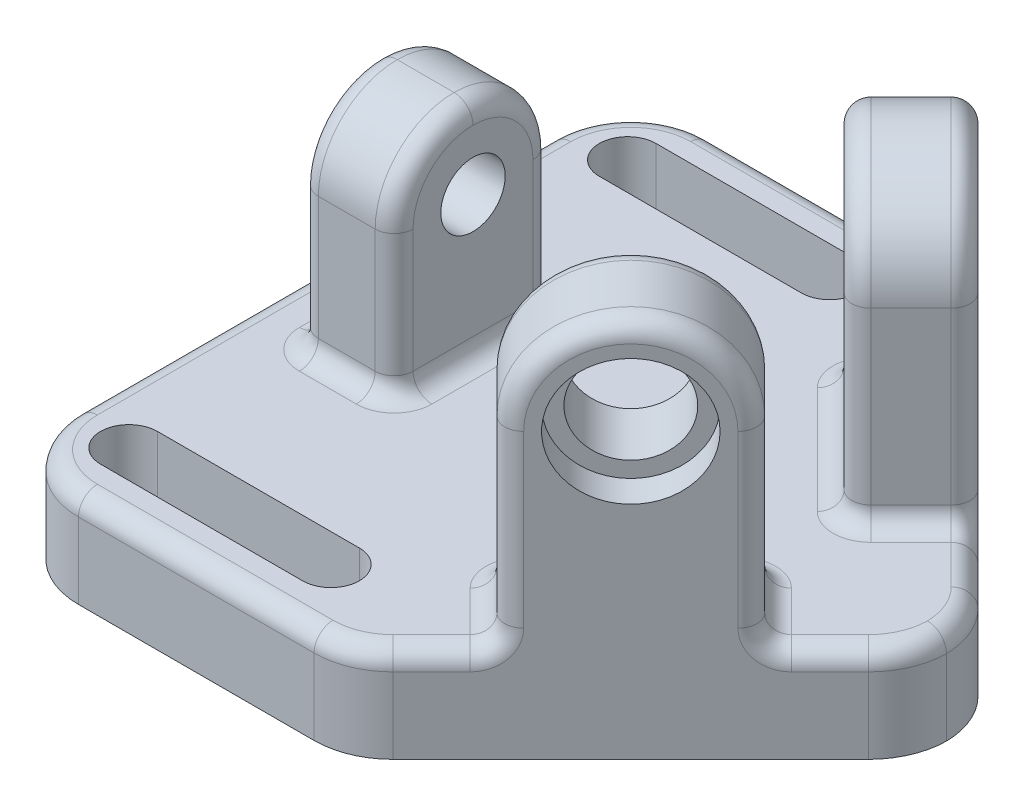
from build123d import *

# Parameters (mm, degrees)
ESBO_O1_W                                            = 100
ESBO_O1_H                                            = 100.00000000000001
RESSALTO_EXTRUS_O1_DEPTH                             = 15
CHANFRO1_SIZE                                        = 45
RESSALTO_EXTRUS_O2_DEPTH                             = 15
REBAIXO_PARA_PARAFUSO_ALLEN_SEXTAVADO_DE_D           = 15
REBAIXO_PARA_PARAFUSO_ALLEN_SEXTAVADO_DE_CBORE_D     = 20
REBAIXO_PARA_PARAFUSO_ALLEN_SEXTAVADO_DE_CBORE_DEPTH = 5
ESBO_O6_W                                            = 15
ESBO_O6_H                                            = 25.000000000000004
RESSALTO_EXTRUS_O3_DEPTH                             = 35
FILETE1_R                                            = 12.5
FURO_ROSCADO_DE_M121_D                               = 10.2
CORTE_EXTRUS_O1_DEPTH                                = 35
FILETE2_R                                            = 12.5
FILETE4_R                                            = 12.5
FILETE5_R                                            = 3


# Some blends are built 0.0001 mm under size
with BuildPart() as part:
    # Esboço1 → Ressalto-extrusão1 (new body)
    with BuildSketch(Plane(origin=(0, 0, 0), x_dir=(1, 0, 0), z_dir=(0, 1, 0))):
        Rectangle(ESBO_O1_W, ESBO_O1_H)
    extrude(amount=-RESSALTO_EXTRUS_O1_DEPTH)

    # Chanfro1
    chanfro1_edges = [part.edges().sort_by_distance(p)[0] for p in [
        (49.99999999999999, -7.5, 50),
        (49.99999999999999, -7.5, -50),
    ]]
    chamfer(chanfro1_edges, length=CHANFRO1_SIZE)

    # Esboço2 → Ressalto-extrusão2 (add)
    with BuildSketch(Plane(origin=(27.500000000000025, 0, 27.499999999999932), x_dir=(0.7071067811865465, 0, -0.7071067811865487), z_dir=(0.7071067811865487, 0, 0.7071067811865465))):
        with BuildLine():
            Line((-15, 0), (15, 0))
            Line((15, 0), (15, 30))
            ThreePointArc((15, 30), (9.2e-16, 45), (-15, 30))
            Line((-15, 30), (-15, 0))
        make_face()
    ressalto_extrus_o2 = extrude(amount=-RESSALTO_EXTRUS_O2_DEPTH)

    # Rebaixo para parafuso Allen sextavado de M121 (through all)
    with Locations(Plane(origin=(27.500000000000025, 0, 27.499999999999932), x_dir=(0.7071067811865465, 0, -0.7071067811865487), z_dir=(0.7071067811865487, 0, 0.7071067811865465))):
        with Locations((0, 30)):
            rebaixo_para_parafuso_allen_sextavado_de = CounterBoreHole(REBAIXO_PARA_PARAFUSO_ALLEN_SEXTAVADO_DE_D / 2, REBAIXO_PARA_PARAFUSO_ALLEN_SEXTAVADO_DE_CBORE_D / 2, REBAIXO_PARA_PARAFUSO_ALLEN_SEXTAVADO_DE_CBORE_DEPTH)

    # Espelhar1: Ressalto-extrusão2, Rebaixo para parafuso Allen sextavado de M121 across plane
    add(ressalto_extrus_o2.mirror(Plane.XY))
    add(rebaixo_para_parafuso_allen_sextavado_de.mirror(Plane.XY), mode=Mode.SUBTRACT)

    # Esboço6 → Ressalto-extrusão3 (add)
    with BuildSketch(Plane(origin=(0, 0, 0), x_dir=(1, 0, 0), z_dir=(0, 1, 0))):
        with Locations((-32.50000000000001, 0)):
            Rectangle(ESBO_O6_W, ESBO_O6_H)
    extrude(amount=RESSALTO_EXTRUS_O3_DEPTH)

    # Filete1
    filete1_edges = [part.edges().sort_by_distance(p)[0] for p in [
        (-32.50000000000001, 35, -12.5),
        (-32.50000000000001, 35, 12.5),
    ]]
    fillet(filete1_edges, radius=FILETE1_R - 0.0001)  # a hair under: the kernel refuses the full size

    # Furo roscado de M121 (through all)
    with Locations(Plane.ZY.offset(40.00000000000001)):
        with Locations((0, 22.5)):
            Hole(FURO_ROSCADO_DE_M121_D / 2)

    # Esboço9 → Corte-extrusão1 (cut)
    with BuildSketch(Plane(origin=(0, 0, 0), x_dir=(1, 0, 0), z_dir=(0, 1, 0))):
        with BuildLine():
            Line((-8.000000000000007, 34.99999999999999), (-40.00000000000001, 34.99999999999999))
            ThreePointArc((-40.00000000000001, 34.99999999999999), (-44.500000000000014, 39.499999999999986), (-40.00000000000001, 43.99999999999999))
            Line((-40.00000000000001, 43.99999999999999), (-8.000000000000009, 44))
            ThreePointArc((-8.000000000000009, 44), (-3.500000000000007, 39.49999999999999), (-8.000000000000007, 34.99999999999999))
        make_face()
    corte_extrus_o1 = extrude(amount=-CORTE_EXTRUS_O1_DEPTH, mode=Mode.SUBTRACT)

    # Espelhar2: Corte-extrusão1 across plane
    add(corte_extrus_o1.mirror(Plane.XY), mode=Mode.SUBTRACT)

    # Filete2
    filete2_edges = [part.edges().sort_by_distance(p)[0] for p in [
        (4.999999999999993, -7.5, 50),
        (-50.00000000000001, -7.5, 50),
        (-50.00000000000001, -7.5, -50),
    ]]
    fillet(filete2_edges, radius=FILETE2_R)

    # Filete4
    # the kernel refuses this fillet: 12.5 mm, written as the material it takes off along each edge
    with BuildSketch(Plane(origin=(4.999999999999993, 12.944173824159222, -50), x_dir=(-1, 0, 0), z_dir=(0, -1, 0))) as filete4_piece_1:
        with BuildLine():
            CenterArc((FILETE4_R * 0.414213562373, -FILETE4_R), FILETE4_R, 90, 45)
            Line((-FILETE4_R * 0.292893218813, -FILETE4_R * 0.292893218813), (0, 0))
            Line((0, 0), (FILETE4_R * 0.414213562373, 0))
        make_face()
    extrude(amount=40.888347648318444, mode=Mode.SUBTRACT)
    with BuildSketch(Plane(origin=(49.99999999999999, 12.944173824159222, -5), x_dir=(-0.7071067811865472, 0, -0.7071067811865479), z_dir=(0, -1, 0))) as filete4_piece_2:
        with BuildLine():
            CenterArc((FILETE4_R * 0.414213562373, -FILETE4_R), FILETE4_R, 89.99999999999997, 44.99999999999997)
            Line((-FILETE4_R * 0.292893218813, -FILETE4_R * 0.292893218813), (0, 0))
            Line((0, 0), (FILETE4_R * 0.414213562373, -1.2e-16))
        make_face()
    extrude(amount=40.888347648318444, mode=Mode.SUBTRACT)
    with BuildSketch(Plane(origin=(50, 12.944173824159222, 4.9999999999999964), x_dir=(-0.7071067811865479, 0, 0.7071067811865471), z_dir=(0, -1, 0))) as filete4_piece_3:
        with BuildLine():
            CenterArc((FILETE4_R * 0.414213562373, FILETE4_R), FILETE4_R, 225, 44.99999999999994)
            Line((-FILETE4_R * 0.292893218813, FILETE4_R * 0.292893218813), (0, 0))
            Line((0, 0), (FILETE4_R * 0.414213562373, -5.5e-16))
        make_face()
    extrude(amount=40.888347648318444, mode=Mode.SUBTRACT)

    # Filete5
    # the kernel refuses this fillet: 3 mm, written as the material it takes off along each edge
    with BuildSketch(Plane(origin=(16.893398282201794, 30, 16.893398282201737), x_dir=(0.7071067811865465, 0, -0.7071067811865486), z_dir=(0, -1, 0))) as filete5_piece_1:
        with BuildLine():
            CenterArc((15.000000000000002 - FILETE5_R, FILETE5_R), FILETE5_R, 269.99999999999994, 90.0000000000001)
            Line((15.000000000000007, FILETE5_R), (15.000000000000002, 2e-16))
            Line((15.000000000000002, 2e-16), (15.000000000000002 - FILETE5_R, -2.5e-15))
        make_face()
    revolve(axis=Axis((16.893398282201794, 30, 16.893398282201737), (0.7071067811865487, 0, 0.7071067811865465)), revolution_arc=180, mode=Mode.SUBTRACT)
    with BuildSketch(Plane(origin=(6.286796564403597, 30, 27.499999999999968), x_dir=(0.7071067811865464, 0, -0.7071067811865487), z_dir=(0, -1, 0))) as filete5_piece_2:
        with BuildLine():
            CenterArc((FILETE5_R, FILETE5_R), FILETE5_R, 179.99999999999991, 90.00000000000011)
            Line((-1e-17, FILETE5_R), (0, 0))
            Line((0, 0), (FILETE5_R, -2e-17))
        make_face()
    extrude(amount=30, mode=Mode.SUBTRACT)
    with BuildSketch(Plane(origin=(27.499999999999993, 0, 6.286796564403506), x_dir=(0.7071067811865487, 0, 0.7071067811865464), z_dir=(0, 1, 0))) as filete5_piece_3:
        with BuildLine():
            CenterArc((FILETE5_R, -FILETE5_R), FILETE5_R, 90, 89.99999999999994)
            Line((-2.49e-15, -FILETE5_R), (0, 0))
            Line((0, 0), (FILETE5_R, 6e-17))
        make_face()
    extrude(amount=30, mode=Mode.SUBTRACT)
    with BuildSketch(Plane(origin=(27.499999999999993, 0, -6.286796564403513), x_dir=(-0.7071067811865446, 0, -0.7071067811865506), z_dir=(0, 1, 0))) as filete5_piece_4:
        with BuildLine():
            CenterArc((FILETE5_R, -FILETE5_R), FILETE5_R, 90.00000000000016, 89.99999999999982)
            Line((5.21e-15, -FILETE5_R), (0, 0))
            Line((0, 0), (FILETE5_R, 1.2e-16))
        make_face()
    extrude(amount=30, mode=Mode.SUBTRACT)
    with BuildSketch(Plane(origin=(16.893398282201797, 30, -16.89339828220175), x_dir=(0.7071067811865462, 0, 0.7071067811865488), z_dir=(0, -1, 0))) as filete5_piece_5:
        with BuildLine():
            CenterArc((15.000000000000004 - FILETE5_R, -FILETE5_R), FILETE5_R, 3.393e-14, 89.99999999999994)
            Line((15.000000000000004, -FILETE5_R), (15.000000000000004, 8.4e-16))
            Line((15.000000000000004, 8.4e-16), (15.000000000000004 - FILETE5_R, -2.42e-15))
        make_face()
    revolve(axis=Axis((16.893398282201797, 30, -16.89339828220175), (-0.7071067811865487, 0, 0.7071067811865465)), revolution_arc=180, mode=Mode.SUBTRACT)
    with BuildSketch(Plane(origin=(6.286796564403595, 30, -27.49999999999998), x_dir=(0.7071067811865517, 0, -0.7071067811865434), z_dir=(0, -1, 0))) as filete5_piece_6:
        with BuildLine():
            CenterArc((FILETE5_R, FILETE5_R), FILETE5_R, 180.00000000000006, 89.99999999999972)
            Line((1.507e-14, FILETE5_R), (0, 0))
            Line((0, 0), (FILETE5_R, -1.7e-16))
        make_face()
    extrude(amount=30, mode=Mode.SUBTRACT)
    with BuildSketch(Plane(origin=(-40.00000000000001, 0, 12.500000000000002), x_dir=(0, 0, -1), z_dir=(0, 1, 0))) as filete5_piece_7:
        with BuildLine():
            CenterArc((FILETE5_R, -FILETE5_R), FILETE5_R, 90, 90)
            Line((3.55e-15, -FILETE5_R), (0, 0))
            Line((0, 0), (FILETE5_R, 0))
        make_face()
    extrude(amount=22.500100000000003, mode=Mode.SUBTRACT)
    with BuildSketch(Plane(origin=(-40.00000000000001, 0, -12.500000000000002), x_dir=(1, 0, 0), z_dir=(0, 1, 0))) as filete5_piece_8:
        with BuildLine():
            CenterArc((FILETE5_R, -FILETE5_R), FILETE5_R, 90, 90)
            Line((0, -FILETE5_R), (0, 0))
            Line((0, 0), (FILETE5_R, 0))
        make_face()
    extrude(amount=22.500100000000003, mode=Mode.SUBTRACT)
    with BuildSketch(Plane(origin=(-40.00000000000001, 22.500100000000003, 0.00010000000000332), x_dir=(0, 0, 1), z_dir=(0, -1, 0))) as filete5_piece_9:
        with BuildLine():
            CenterArc((12.4999 - FILETE5_R, -FILETE5_R), FILETE5_R, 0, 90)
            Line((12.499900000000002, -FILETE5_R), (12.4999, 0))
            Line((12.4999, 0), (12.4999 - FILETE5_R, 0))
        make_face()
    revolve(axis=Axis((-40.00000000000001, 22.500100000000003, 0.00010000000000332), (-1, 0, 1.2e-16)), revolution_arc=90, mode=Mode.SUBTRACT)
    with BuildSketch(Plane(origin=(-40.00000000000001, 22.500100000000003, -0.0001000000000051), x_dir=(0, 0, -1), z_dir=(0, -1, 0))) as filete5_piece_10:
        with BuildLine():
            CenterArc((12.4999 - FILETE5_R, FILETE5_R), FILETE5_R, 270, 90)
            Line((12.499899999999998, FILETE5_R), (12.4999, 0))
            Line((12.4999, 0), (12.4999 - FILETE5_R, 0))
        make_face()
    revolve(axis=Axis((-40.00000000000001, 22.500100000000003, -0.0001000000000051), (1, 0, 1.2e-16)), revolution_arc=90, mode=Mode.SUBTRACT)
    with BuildSketch(Plane(origin=(-25.000000000000007, 0, -12.5), x_dir=(-1, 0, 0), z_dir=(0, 1, 0)), Plane(origin=(-25.000000000000007, 0, 12.5), x_dir=(0, 0, -1), z_dir=(0, 1, 0))) as filete5_piece_11:
        with BuildLine():
            CenterArc((FILETE5_R, FILETE5_R), FILETE5_R, 180, 90)
            Line((0, FILETE5_R), (0, 0))
            Line((0, 0), (FILETE5_R, 0))
        make_face()
    extrude(amount=22.500100000000003, mode=Mode.SUBTRACT)
    with BuildSketch(Plane(origin=(-25.000000000000007, 22.500100000000003, 0.00010000000000154), x_dir=(0, 0, 1), z_dir=(0, -1, 0))) as filete5_piece_12:
        with BuildLine():
            CenterArc((12.4999 - FILETE5_R, FILETE5_R), FILETE5_R, 270, 90)
            Line((12.4999, FILETE5_R), (12.4999, 0))
            Line((12.4999, 0), (12.4999 - FILETE5_R, 0))
        make_face()
    revolve(axis=Axis((-25.000000000000007, 22.500100000000003, 0.00010000000000154), (-1, 0, 1.2e-16)), revolution_arc=90, mode=Mode.SUBTRACT)
    with BuildSketch(Plane(origin=(-25.000000000000007, 22.500100000000003, -0.00010000000000332), x_dir=(0, 0, -1), z_dir=(0, -1, 0))) as filete5_piece_13:
        with BuildLine():
            CenterArc((12.4999 - FILETE5_R, -FILETE5_R), FILETE5_R, 0, 90)
            Line((12.4999, -FILETE5_R), (12.4999, 0))
            Line((12.4999, 0), (12.4999 - FILETE5_R, 0))
        make_face()
    revolve(axis=Axis((-25.000000000000007, 22.500100000000003, -0.00010000000000332), (1, 0, 1.2e-16)), revolution_arc=90, mode=Mode.SUBTRACT)
    with BuildSketch(Plane(origin=(-25.000000000000007, 35, 0.00010000000000154), x_dir=(0, -1, 0), z_dir=(0, 0, -1))) as filete5_piece_14:
        with BuildLine():
            CenterArc((FILETE5_R, FILETE5_R), FILETE5_R, 180, 90)
            Line((0, FILETE5_R), (0, 0))
            Line((0, 0), (FILETE5_R, 0))
        make_face()
    extrude(amount=0.00020000000000486, mode=Mode.SUBTRACT)
    with BuildSketch(Plane(origin=(-40.00000000000001, 35, -0.0001000000000051), x_dir=(0, -1, 0), z_dir=(0, 0, 1))) as filete5_piece_15:
        with BuildLine():
            CenterArc((FILETE5_R, FILETE5_R), FILETE5_R, 180, 90)
            Line((0, FILETE5_R), (0, 0))
            Line((0, 0), (FILETE5_R, 0))
        make_face()
    extrude(amount=0.00020000000000842, mode=Mode.SUBTRACT)
    # the kernel refuses this fillet: 3 mm, written as the material it adds along each edge
    with BuildSketch(Plane(origin=(8.408116907963237, 0, 25.37867965644032), x_dir=(-0.7071067811865487, 0, -0.7071067811865464), z_dir=(0.7071067811865465, 0, -0.7071067811865487))) as filete5_2_piece_1:
        with BuildLine():
            CenterArc((FILETE5_R, FILETE5_R), FILETE5_R, 180, 90)
            Line((0, FILETE5_R), (0, 0))
            Line((0, 0), (FILETE5_R, 0))
        make_face()
    extrude(amount=24.00000000000001)
    with BuildSketch(Plane(origin=(38.10660171779822, 0, 16.8933982822017), x_dir=(0.7071067811865464, 0, -0.7071067811865487), z_dir=(-0.7071067811865487, 0, -0.7071067811865464))) as filete5_2_piece_2:
        with BuildLine():
            CenterArc((FILETE5_R, -FILETE5_R), FILETE5_R, 90, 90)
            Line((0, -FILETE5_R), (0, 0))
            Line((0, 0), (FILETE5_R, 0))
        make_face()
    extrude(amount=11.999999999999996)
    with BuildSketch(Plane(origin=(16.89339828220183, 0, 38.10660171779816), x_dir=(-0.7071067811865464, 0, 0.7071067811865487), z_dir=(-0.7071067811865487, 0, -0.7071067811865464))) as filete5_2_piece_3:
        with BuildLine():
            CenterArc((FILETE5_R, FILETE5_R), FILETE5_R, 180, 90)
            Line((0, FILETE5_R), (0, 0))
            Line((0, 0), (FILETE5_R, 0))
        make_face()
    extrude(amount=11.999999999999998)
    with BuildSketch(Plane(origin=(16.89339828220183, 0, -38.10660171779816), x_dir=(-0.7071067811865464, 0, -0.7071067811865487), z_dir=(-0.7071067811865487, 0, 0.7071067811865464))) as filete5_2_piece_4:
        with BuildLine():
            CenterArc((FILETE5_R, -FILETE5_R), FILETE5_R, 90, 90)
            Line((0, -FILETE5_R), (0, 0))
            Line((0, 0), (FILETE5_R, 0))
        make_face()
    extrude(amount=11.999999999999995)
    with BuildSketch(Plane(origin=(38.10660171779822, 0, -16.8933982822017), x_dir=(0.7071067811865464, 0, 0.7071067811865487), z_dir=(-0.7071067811865487, 0, 0.7071067811865464))) as filete5_2_piece_5:
        with BuildLine():
            CenterArc((FILETE5_R, FILETE5_R), FILETE5_R, 180, 90)
            Line((0, FILETE5_R), (0, 0))
            Line((0, 0), (FILETE5_R, 0))
        make_face()
    extrude(amount=11.999999999999996)
    with BuildSketch(Plane(origin=(8.408116907963233, 0, -25.378679656440333), x_dir=(-0.7071067811865487, 0, 0.7071067811865464), z_dir=(0.7071067811865465, 0, 0.7071067811865487))) as filete5_2_piece_6:
        with BuildLine():
            CenterArc((FILETE5_R, -FILETE5_R), FILETE5_R, 90, 90)
            Line((-2.51e-15, -FILETE5_R), (0, 0))
            Line((0, 0), (FILETE5_R, 0))
        make_face()
    extrude(amount=24.000000000000018)
    with BuildSketch(Plane(origin=(-40.00000000000001, 0, -9.5), x_dir=(-1, 0, 0), z_dir=(0, 0, 1))) as filete5_2_piece_7:
        with BuildLine():
            CenterArc((FILETE5_R, -FILETE5_R), FILETE5_R, 90, 90)
            Line((0, -FILETE5_R), (0, 0))
            Line((0, 0), (FILETE5_R, 0))
        make_face()
    extrude(amount=19)
    with BuildSketch(Plane(origin=(-37.00000000000001, 0, 12.500000000000002), x_dir=(1.2e-16, 0, 1), z_dir=(1, 0, -1.2e-16)), Plane(origin=(-28.000000000000007, 0, -12.5), x_dir=(1.2e-16, 0, -1), z_dir=(-1, 0, -1.2e-16))) as filete5_2_piece_8:
        with BuildLine():
            CenterArc((FILETE5_R, -FILETE5_R), FILETE5_R, 90, 90)
            Line((0, -FILETE5_R), (0, 0))
            Line((0, 0), (FILETE5_R, 0))
        make_face()
    extrude(amount=9)
    with BuildSketch(Plane(origin=(-25.000000000000007, 0, 9.5), x_dir=(1, 0, 0), z_dir=(0, 0, -1))) as filete5_2_piece_9:
        with BuildLine():
            CenterArc((FILETE5_R, -FILETE5_R), FILETE5_R, 90, 90)
            Line((0, -FILETE5_R), (0, 0))
            Line((0, 0), (FILETE5_R, 0))
        make_face()
    extrude(amount=19)
    with BuildSketch(Plane(origin=(-28.000000000000007, 0, -9.5), x_dir=(0, 0, -1), z_dir=(-1, 0, 0))) as filete5_2_piece_10:
        with BuildLine():
            CenterArc((3 + FILETE5_R, -FILETE5_R), FILETE5_R, 90, 90)
            Line((3, -FILETE5_R), (3, 0))
            Line((3, 0), (3 + FILETE5_R, 0))
        make_face()
    revolve(axis=Axis((-28.000000000000007, 0, -9.5), (0, -1, 0)), revolution_arc=90)
    with BuildSketch(Plane(origin=(-37.00000000000001, 0, -9.500000000000002), x_dir=(0, 0, -1), z_dir=(1, 0, 0))) as filete5_2_piece_11:
        with BuildLine():
            CenterArc((3 + FILETE5_R, FILETE5_R), FILETE5_R, 180, 90)
            Line((3, FILETE5_R), (3, 0))
            Line((3, 0), (3 + FILETE5_R, 0))
        make_face()
    revolve(axis=Axis((-37.00000000000001, 0, -9.500000000000002), (0, 1, 0)), revolution_arc=90.00000000000004)
    with BuildSketch(Plane(origin=(-28.000000000000007, 0, 9.5), x_dir=(1, 0, 0), z_dir=(0, 0, -1))) as filete5_2_piece_12:
        with BuildLine():
            CenterArc((3 + FILETE5_R, -FILETE5_R), FILETE5_R, 90, 90)
            Line((3, -FILETE5_R), (3, 0))
            Line((3, 0), (3 + FILETE5_R, 0))
        make_face()
    revolve(axis=Axis((-28.000000000000007, 0, 9.5), (0, -1, 0)), revolution_arc=90)
    with BuildSketch(Plane(origin=(-37.00000000000001, 0, 9.499999999999998), x_dir=(-1, 0, 0), z_dir=(0, 0, -1))) as filete5_2_piece_13:
        with BuildLine():
            CenterArc((3 + FILETE5_R, FILETE5_R), FILETE5_R, 180, 90)
            Line((3, FILETE5_R), (3, 0))
            Line((3, 0), (3 + FILETE5_R, 0))
        make_face()
    revolve(axis=Axis((-37.00000000000001, 0, 9.499999999999998), (0, 1, 0)), revolution_arc=90)
    with BuildSketch(Plane(origin=(10.52943725152289, 0, -27.499999999999964), x_dir=(-0.7071067811865464, 0, -0.7071067811865487), z_dir=(0.7071067811865487, 0, -0.7071067811865464))) as filete5_2_piece_14:
        with BuildLine():
            CenterArc((2.999999999999999 + FILETE5_R, FILETE5_R), FILETE5_R, 180, 90)
            Line((2.999999999999999, FILETE5_R), (2.999999999999999, 0))
            Line((2.999999999999999, 0), (2.999999999999999 + FILETE5_R, 0))
        make_face()
    revolve(axis=Axis((10.52943725152289, 0, -27.499999999999964), (0, 1, 0)), revolution_arc=89.99999999999972)
    with BuildSketch(Plane(origin=(27.500000000000007, 0, -10.5294372515228), x_dir=(-0.7071067811865487, 0, 0.7071067811865464), z_dir=(-0.7071067811865464, 0, -0.7071067811865487))) as filete5_2_piece_15:
        with BuildLine():
            CenterArc((2.999999999999999 + FILETE5_R, FILETE5_R), FILETE5_R, 180, 90)
            Line((2.999999999999999, FILETE5_R), (2.999999999999999, 0))
            Line((2.999999999999999, 0), (2.999999999999999 + FILETE5_R, 0))
        make_face()
    revolve(axis=Axis((27.500000000000007, 0, -10.5294372515228), (0, 1, 0)), revolution_arc=89.99999999999982)
    with BuildSketch(Plane(origin=(10.52943725152288, 0, 27.49999999999996), x_dir=(-0.7071067811865487, 0, -0.7071067811865464), z_dir=(0.7071067811865464, 0, -0.7071067811865487))) as filete5_2_piece_16:
        with BuildLine():
            CenterArc((2.999999999999999 + FILETE5_R, FILETE5_R), FILETE5_R, 180, 90)
            Line((3.0000000000000004, FILETE5_R), (2.999999999999999, 0))
            Line((2.999999999999999, 0), (2.999999999999999 + FILETE5_R, 0))
        make_face()
    revolve(axis=Axis((10.52943725152288, 0, 27.49999999999996), (0, 1, 0)), revolution_arc=90.0000000000001)
    with BuildSketch(Plane(origin=(27.5, 0, 10.52943725152279), x_dir=(0.7071067811865464, 0, -0.7071067811865487), z_dir=(0.7071067811865487, 0, 0.7071067811865464))) as filete5_2_piece_17:
        with BuildLine():
            CenterArc((2.999999999999999 + FILETE5_R, FILETE5_R), FILETE5_R, 180, 90)
            Line((2.999999999999999, FILETE5_R), (2.999999999999999, 0))
            Line((2.999999999999999, 0), (2.999999999999999 + FILETE5_R, 0))
        make_face()
    revolve(axis=Axis((27.5, 0, 10.52943725152279), (0, 1, 0)), revolution_arc=89.99999999999994)
    # the kernel refuses this fillet: 3 mm, written as the material it takes off along each edge
    with BuildSketch(Plane(origin=(-37.500000000000014, 0, 50), x_dir=(0, 0, -1), z_dir=(1, 0, 0))) as filete5_3_piece_1:
        with BuildLine():
            CenterArc((FILETE5_R, -FILETE5_R), FILETE5_R, 90, 90)
            Line((0, -FILETE5_R), (0, 0))
            Line((0, 0), (FILETE5_R, 0))
        make_face()
    extrude(amount=37.32233047033633, mode=Mode.SUBTRACT)
    with BuildSketch(Plane(origin=(-50.00000000000001, 0, -37.5), x_dir=(1, 0, 0), z_dir=(0, 0, 1))) as filete5_3_piece_2:
        with BuildLine():
            CenterArc((FILETE5_R, -FILETE5_R), FILETE5_R, 90, 90)
            Line((0, -FILETE5_R), (0, 0))
            Line((0, 0), (FILETE5_R, 0))
        make_face()
    extrude(amount=75, mode=Mode.SUBTRACT)
    with BuildSketch(Plane(origin=(8.661165235168156, 0, 46.338834764831844), x_dir=(-0.7071067811865476, 0, -0.7071067811865476), z_dir=(0.7071067811865476, 0, -0.7071067811865476))) as filete5_3_piece_3:
        with BuildLine():
            CenterArc((FILETE5_R, -FILETE5_R), FILETE5_R, 90, 90)
            Line((2.51e-15, -FILETE5_R), (0, 0))
            Line((0, 0), (FILETE5_R, 0))
        make_face()
    extrude(amount=8.642135623731017, mode=Mode.SUBTRACT)
    with BuildSketch(Plane(origin=(-37.500000000000014, 0, 37.5), x_dir=(0, 0, 1), z_dir=(1, 0, 0))) as filete5_3_piece_4:
        with BuildLine():
            CenterArc((12.5 - FILETE5_R, FILETE5_R), FILETE5_R, 270, 89.99999999999999)
            Line((12.5, FILETE5_R), (12.5, 0))
            Line((12.5, 0), (12.5 - FILETE5_R, 0))
        make_face()
    revolve(axis=Axis((-37.500000000000014, 0, 37.5), (0, -1, 0)), revolution_arc=90, mode=Mode.SUBTRACT)
    with BuildSketch(Plane(origin=(-37.500000000000014, 0, -37.5), x_dir=(-1, 0, 0), z_dir=(0, 0, 1))) as filete5_3_piece_5:
        with BuildLine():
            CenterArc((12.5 - FILETE5_R, FILETE5_R), FILETE5_R, 270, 89.99999999999999)
            Line((12.5, FILETE5_R), (12.5, 0))
            Line((12.5, 0), (12.5 - FILETE5_R, 0))
        make_face()
    revolve(axis=Axis((-37.500000000000014, 0, -37.5), (0, -1, 0)), revolution_arc=90, mode=Mode.SUBTRACT)
    with BuildSketch(Plane(origin=(-0.1776695296636852, 0, 37.5), x_dir=(-1.2e-16, 0, 1), z_dir=(-1, 0, -1.2e-16))) as filete5_3_piece_6:
        with BuildLine():
            CenterArc((12.5 - FILETE5_R, -FILETE5_R), FILETE5_R, 8.48e-15, 90)
            Line((12.5, -FILETE5_R), (12.5, 0))
            Line((12.5, 0), (12.5 - FILETE5_R, 0))
        make_face()
    revolve(axis=Axis((-0.1776695296636852, 0, 37.5), (0, 1, 0)), revolution_arc=44.99999999999997, mode=Mode.SUBTRACT)
    with BuildSketch(Plane(origin=(-0.17766952966250216, 0, -50), x_dir=(0, 0, 1), z_dir=(-1, 0, 0))) as filete5_3_piece_7:
        with BuildLine():
            CenterArc((FILETE5_R, -FILETE5_R), FILETE5_R, 90, 90)
            Line((0, -FILETE5_R), (0, 0))
            Line((0, 0), (FILETE5_R, 0))
        make_face()
    extrude(amount=37.322330470337505, mode=Mode.SUBTRACT)
    with BuildSketch(Plane(origin=(46.33883476483268, 0, -8.661165235167314), x_dir=(-0.7071067811865476, 0, 0.7071067811865476), z_dir=(-0.7071067811865476, 0, -0.7071067811865476))) as filete5_3_piece_8:
        with BuildLine():
            CenterArc((FILETE5_R, -FILETE5_R), FILETE5_R, 90, 90)
            Line((3.77e-15, -FILETE5_R), (0, 0))
            Line((0, 0), (FILETE5_R, 0))
        make_face()
    extrude(amount=8.642135623732074, mode=Mode.SUBTRACT)
    with BuildSketch(Plane(origin=(37.50000000000084, 0, -0.1776695296645281), x_dir=(0.7071067811865477, 0, 0.7071067811865474), z_dir=(-0.7071067811865474, 0, 0.7071067811865477))) as filete5_3_piece_9:
        with BuildLine():
            CenterArc((12.499999999999998 - FILETE5_R, -FILETE5_R), FILETE5_R, 0, 90)
            Line((12.499999999999998, -FILETE5_R), (12.499999999999998, 0))
            Line((12.499999999999998, 0), (12.499999999999998 - FILETE5_R, 0))
        make_face()
    revolve(axis=Axis((37.50000000000084, 0, -0.1776695296645281), (0, 1, 0)), revolution_arc=78.56639103335827, mode=Mode.SUBTRACT)
    with BuildSketch(Plane(origin=(37.50000000000084, 0, 0.1776695296645281), x_dir=(0.8332457097523328, 0, 0.5529028731878061), z_dir=(-0.5529028731878061, 0, 0.8332457097523328))) as filete5_3_piece_10:
        with BuildLine():
            CenterArc((12.500000000000265 - FILETE5_R, -FILETE5_R), FILETE5_R, 0, 90)
            Line((12.500000000000265, -FILETE5_R), (12.500000000000265, 0))
            Line((12.500000000000265, 0), (12.500000000000265 - FILETE5_R, 0))
        make_face()
    revolve(axis=Axis((37.50000000000084, 0, 0.1776695296645281), (0, 1, 0)), revolution_arc=78.56639103335854, mode=Mode.SUBTRACT)
    with BuildSketch(Plane(origin=(-0.17766952966250038, 0, -37.5), x_dir=(0.7071067811865476, 0, -0.7071067811865475), z_dir=(0.7071067811865475, 0, 0.7071067811865476))) as filete5_3_piece_11:
        with BuildLine():
            CenterArc((12.500000000000002 - FILETE5_R, -FILETE5_R), FILETE5_R, 0, 90)
            Line((12.499999999999998, -FILETE5_R), (12.500000000000002, 0))
            Line((12.500000000000002, 0), (12.500000000000002 - FILETE5_R, 0))
        make_face()
    revolve(axis=Axis((-0.17766952966250038, 0, -37.5), (0, 1, 0)), revolution_arc=45, mode=Mode.SUBTRACT)
    with BuildSketch(Plane(origin=(40.2279220613579, 0, 14.772077938642097), x_dir=(-0.7071067811865476, 0, -0.7071067811865476), z_dir=(0.7071067811865476, 0, -0.7071067811865476))) as filete5_3_piece_12:
        with BuildLine():
            CenterArc((FILETE5_R, -FILETE5_R), FILETE5_R, 90, 90)
            Line((3.77e-15, -FILETE5_R), (0, 0))
            Line((0, 0), (FILETE5_R, 0))
        make_face()
    extrude(amount=8.642135623732074, mode=Mode.SUBTRACT)
    with BuildSketch(Plane(origin=(38.10660171779822, 3, 16.8933982822017), x_dir=(-0.7071067811865357, 0, 0.7071067811865595), z_dir=(0, 1, 0))) as filete5_3_piece_13:
        with BuildLine():
            CenterArc((FILETE5_R, -FILETE5_R), FILETE5_R, 89.99999999999909, 90.00000000000102)
            Line((-4.535e-14, -FILETE5_R), (0, 0))
            Line((0, 0), (FILETE5_R, -1.3e-16))
        make_face()
    extrude(amount=27, mode=Mode.SUBTRACT)
    with BuildSketch(Plane(origin=(27.500000000000025, 30, 27.499999999999932), x_dir=(0.7071067811865462, 0, -0.7071067811865487), z_dir=(0, -1, 0))) as filete5_3_piece_14:
        with BuildLine():
            CenterArc((15 - FILETE5_R, -FILETE5_R), FILETE5_R, 359.999999999999, 90.00000000000108)
            Line((15, -FILETE5_R), (15, 7.8e-16))
            Line((15, 7.8e-16), (15 - FILETE5_R, 4.567e-14))
        make_face()
    revolve(axis=Axis((27.500000000000025, 30, 27.499999999999932), (0.7071067811865487, 0, 0.7071067811865465)), revolution_arc=180, mode=Mode.SUBTRACT)
    with BuildSketch(Plane(origin=(16.89339828220183, 30, 38.10660171779816), x_dir=(0.7071067811865475, 0, -0.7071067811865475), z_dir=(0, -1, 0))) as filete5_3_piece_15:
        with BuildLine():
            CenterArc((FILETE5_R, -FILETE5_R), FILETE5_R, 90.00000000000006, 89.99999999999972)
            Line((-5.01e-15, -FILETE5_R), (0, 0))
            Line((0, 0), (FILETE5_R, -2e-17))
        make_face()
    extrude(amount=27, mode=Mode.SUBTRACT)
    with BuildSketch(Plane(origin=(14.772077938642191, 0, -40.22792206135781), x_dir=(-0.7071067811865476, 0, 0.7071067811865476), z_dir=(-0.7071067811865476, 0, -0.7071067811865476))) as filete5_3_piece_16:
        with BuildLine():
            CenterArc((FILETE5_R, -FILETE5_R), FILETE5_R, 90, 90)
            Line((2.51e-15, -FILETE5_R), (0, 0))
            Line((0, 0), (FILETE5_R, 0))
        make_face()
    extrude(amount=8.642135623734598, mode=Mode.SUBTRACT)
    with BuildSketch(Plane(origin=(27.500000000000025, 30, -27.49999999999994), x_dir=(0.7071067811865462, 0, 0.7071067811865488), z_dir=(0, -1, 0))) as filete5_3_piece_17:
        with BuildLine():
            CenterArc((15.000000000000004 - FILETE5_R, FILETE5_R), FILETE5_R, 269.99999999999994, 90.00000000000107)
            Line((15.000000000000004, FILETE5_R), (15.000000000000004, 8.4e-16))
            Line((15.000000000000004, 8.4e-16), (15.000000000000004 - FILETE5_R, -4.405e-14))
        make_face()
    revolve(axis=Axis((27.500000000000025, 30, -27.49999999999994), (-0.7071067811865487, 0, 0.7071067811865465)), revolution_arc=180, mode=Mode.SUBTRACT)
    with BuildSketch(Plane(origin=(16.89339828220183, 30, -38.10660171779817), x_dir=(0.7071067811865464, 0, 0.7071067811865488), z_dir=(0, -1, 0))) as filete5_3_piece_18:
        with BuildLine():
            CenterArc((FILETE5_R, FILETE5_R), FILETE5_R, 180.00000000000014, 89.99999999999972)
            Line((-4.85e-15, FILETE5_R), (0, 0))
            Line((0, 0), (FILETE5_R, -1.2e-16))
        make_face()
    extrude(amount=27, mode=Mode.SUBTRACT)
    with BuildSketch(Plane(origin=(38.10660171779823, 3, -16.893398282201698), x_dir=(-0.7071067811865364, 0, -0.7071067811865589), z_dir=(0, 1, 0))) as filete5_3_piece_19:
        with BuildLine():
            CenterArc((FILETE5_R, FILETE5_R), FILETE5_R, 179.99999999999983, 90.00000000000102)
            Line((-4.41e-14, FILETE5_R), (0, 0))
            Line((0, 0), (FILETE5_R, 1.2e-16))
        make_face()
    extrude(amount=27, mode=Mode.SUBTRACT)
    with BuildSketch(Plane(origin=(40.22792206135786, 3, -14.772077938642056), x_dir=(0, -1, 0), z_dir=(0.7071067811865464, 0, 0.7071067811865487))) as filete5_3_piece_20:
        with BuildLine():
            CenterArc((3 + FILETE5_R, -FILETE5_R), FILETE5_R, 90, 90.00000000000114)
            Line((2.9999999999999996, -FILETE5_R), (3, 0))
            Line((3, 0), (3 + FILETE5_R, 5.276e-14))
        make_face()
    revolve(axis=Axis((40.22792206135786, 3, -14.772077938642056), (0.7071067811865487, 0, -0.7071067811865464)), revolution_arc=90, mode=Mode.SUBTRACT)
    with BuildSketch(Plane(origin=(14.772077938642191, 3, -40.22792206135781), x_dir=(0, -1, 0), z_dir=(-0.7071067811865464, 0, -0.7071067811865487))) as filete5_3_piece_21:
        with BuildLine():
            CenterArc((3 + FILETE5_R, FILETE5_R), FILETE5_R, 179.99999999999997, 90)
            Line((2.9999999999999996, FILETE5_R), (3, 0))
            Line((3, 0), (3 + FILETE5_R, 5.02e-15))
        make_face()
    revolve(axis=Axis((14.772077938642191, 3, -40.22792206135781), (-0.7071067811865487, 0, 0.7071067811865464)), revolution_arc=90, mode=Mode.SUBTRACT)
    with BuildSketch(Plane(origin=(14.772077938642191, 3, 40.22792206135781), x_dir=(0, -1, 0), z_dir=(-0.7071067811865464, 0, 0.7071067811865487))) as filete5_3_piece_22:
        with BuildLine():
            CenterArc((3 + FILETE5_R, -FILETE5_R), FILETE5_R, 90, 90)
            Line((2.9999999999999996, -FILETE5_R), (3, 0))
            Line((3, 0), (3 + FILETE5_R, -5.02e-15))
        make_face()
    revolve(axis=Axis((14.772077938642191, 3, 40.22792206135781), (0.7071067811865487, 0, 0.7071067811865464)), revolution_arc=90, mode=Mode.SUBTRACT)
    with BuildSketch(Plane(origin=(40.22792206135786, 3, 14.772077938642056), x_dir=(0, -1, 0), z_dir=(0.7071067811865464, 0, -0.7071067811865487))) as filete5_3_piece_23:
        with BuildLine():
            CenterArc((3 + FILETE5_R, FILETE5_R), FILETE5_R, 179.9999999999989, 90.00000000000114)
            Line((2.9999999999999996, FILETE5_R), (3, 0))
            Line((3, 0), (3 + FILETE5_R, -5.276e-14))
        make_face()
    revolve(axis=Axis((40.22792206135786, 3, 14.772077938642056), (-0.7071067811865487, 0, -0.7071067811865464)), revolution_arc=90, mode=Mode.SUBTRACT)


solid = part.part
